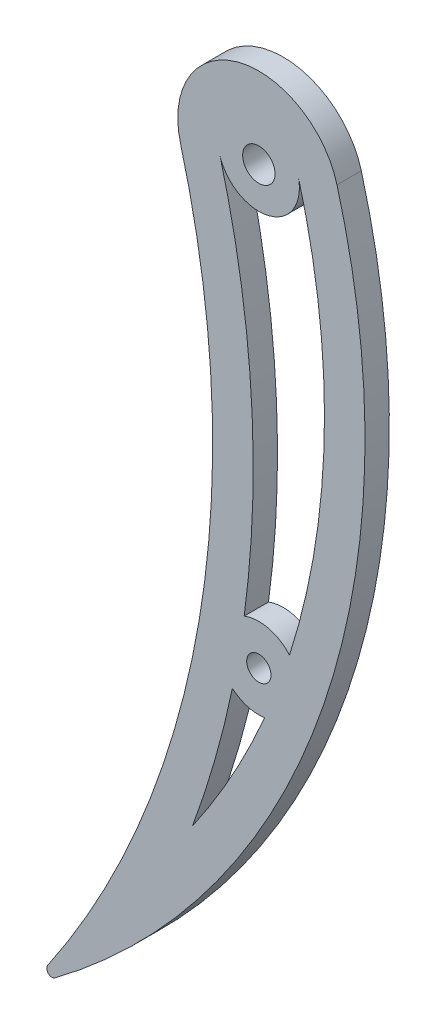
from build123d import *

# Parameters (mm, degrees)
SKETCH1_R           = 2
EXTRUDE1_DEPTH      = 3
CUT_EXTRUDE1_DEPTH  = 10
BOSS_EXTRUDE1_DEPTH = 3
CUT_EXTRUDE2_DEPTH  = 5


with BuildPart() as part:
    # Sketch1 → Extrude1 (new body)
    with BuildSketch(Plane.XY):
        with BuildLine():
            ThreePointArc((-26.085308936, -49.243272897), (-24.983078735, -55.562467556), (-18.568566007, -55.596511855))
            ThreePointArc((-18.568566007, -55.596511855), (9.955092257, -6.447651038), (9.831223687, 50.378348795))
            ThreePointArc((9.831223687, 50.378348795), (4.259504767, 53.557286163), (0.144535316, 48.6362374))
            ThreePointArc((0.144535316, 48.6362374), (0.489229737, -3.910438591), (-26.085308936, -49.243272897))
        make_face()
        with BuildLine():
            ThreePointArc((4.394388405, -6.462715876), (3.695668532, -4.775452102), (5.144535316, -3.6637626))
            ThreePointArc((5.144535316, -3.6637626), (6.5934021, -5.552073099), (4.394388405, -6.462715876))
        make_face(mode=Mode.SUBTRACT)
        with Locations((5.144535316, 48.6362374)):
            Circle(SKETCH1_R, mode=Mode.SUBTRACT)
        with Locations((-21.755464684, -51.7437626)):
            Circle(SKETCH1_R, mode=Mode.SUBTRACT)
    extrude(amount=EXTRUDE1_DEPTH)

    # Sketch3 → Cut-Extrude1 (cut)
    with BuildSketch(Plane(origin=(0, 0, 0), x_dir=(-1, 0, 0), z_dir=(0, 0, -1))):
        with BuildLine():
            ThreePointArc((26.085308936, -49.243272897), (16.272417408, -38.139391171), (8.225333931, -25.696181093))
            ThreePointArc((8.225333931, -25.696181093), (13.854681069, -38.186869472), (20.909608136, -49.931436277))
            ThreePointArc((20.909608136, -49.931436277), (22.829775371, -50.05679593), (23.755464684, -51.7437626))
            ThreePointArc((23.755464684, -51.7437626), (21.27804664, -53.685944881), (19.983392673, -50.816529735))
            ThreePointArc((19.983392673, -50.816529735), (8.408185994, -40.542939738), (-1.362976888, -28.540588427))
            ThreePointArc((-1.362976888, -28.540588427), (7.552683596, -42.842145312), (18.568566007, -55.596511855))
            ThreePointArc((18.568566007, -55.596511855), (24.983078735, -55.562467556), (26.085308936, -49.243272897))
        make_face()
    extrude(amount=-CUT_EXTRUDE1_DEPTH, mode=Mode.SUBTRACT)

    # Sketch3<3> → Boss-Extrude1 (add)
    with BuildSketch(Plane(origin=(0, 0, 0), x_dir=(-1, 0, 0), z_dir=(0, 0, -1))):
        with BuildLine():
            ThreePointArc((8.225333931, -25.696181093), (0.709764151, 9.885397236), (4.515866122, 46.052317111))
            ThreePointArc((4.515866122, 46.052317111), (-2.521867284, 58.28619141), (-14.783886482, 51.297610936))
            ThreePointArc((-14.783886482, 51.297610936), (-16.914814846, 9.892262753), (-1.362976888, -28.540588427))
            ThreePointArc((-1.362976888, -28.540588427), (-13.044605865, 10.119739731), (-9.831223687, 50.378348795))
            ThreePointArc((-9.831223687, 50.378348795), (-4.259504767, 53.557286163), (-0.144535316, 48.6362374))
            ThreePointArc((-0.144535316, 48.6362374), (-3.243862831, 10.649816422), (8.225333931, -25.696181093))
        make_face()
        with BuildLine():
            ThreePointArc((19.983392673, -50.816529735), (20.822206397, -50.767144538), (20.909608136, -49.931436277))
            ThreePointArc((20.909608136, -49.931436277), (20.37371395, -50.297814846), (19.983392673, -50.816529735))
        make_face()
    extrude(amount=-BOSS_EXTRUDE1_DEPTH)

    # Sketch4 → Cut-Extrude2 (cut)
    with BuildSketch(Plane(origin=(0, 0, 0), x_dir=(-1, 0, 0), z_dir=(0, 0, -1))):
        with BuildLine():
            ThreePointArc((-1.879022525, -8.950109944), (-3.738208311, -9.961912697), (-5.849425706, -10.11382619))
            ThreePointArc((-5.849425706, -10.11382619), (-1.805817512, -18.34494551), (3.046878131, -26.126554438))
            ThreePointArc((3.046878131, -26.126554438), (0.268148473, -17.628892121), (-1.879022525, -8.950109944))
        make_face()
        with BuildLine():
            ThreePointArc((-9.964210899, 49.966924168), (-13.222981584, 23.962412042), (-8.924214856, -1.890534442))
            ThreePointArc((-8.924214856, -1.890534442), (-6.34883687, -0.310963638), (-3.333762814, -0.503172193))
            ThreePointArc((-3.333762814, -0.503172193), (-4.204319589, 23.570760268), (-0.314334597, 47.344277255))
            ThreePointArc((-0.314334597, 47.344277255), (-6.455869332, 43.811260395), (-9.964210899, 49.966924168))
        make_face()
    extrude(amount=-CUT_EXTRUDE2_DEPTH, mode=Mode.SUBTRACT)


solid = part.part
